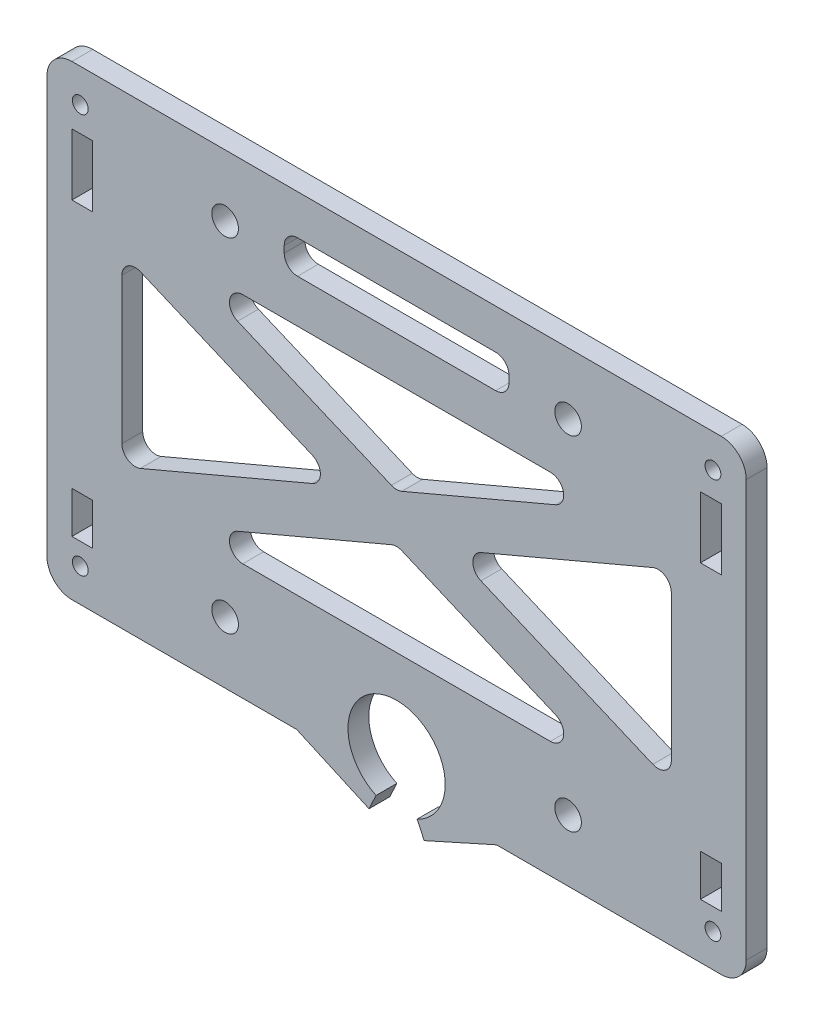
from build123d import *

# Parameters (mm, degrees)
SKETCH1_R           = 0.60325
SKETCH1_R_2         = 1.016
BOSS_EXTRUDE1_DEPTH = 1.5875
SPEED_HOLES_REACH   = 35.53
SKETCH2_W           = 17.145
SKETCH2_H           = 2.54
FILLET1_R           = 1.016
SKETCH5_W           = 1.5875
SKETCH5_H           = 3.175
SKETCH5_H_2         = 4.699
CUT_EXTRUDE1_DEPTH  = 34.530212411


with BuildPart() as part:
    # Sketch1 → Boss-Extrude1 (new body)
    with BuildSketch(Plane.XY):
        with BuildLine():
            ThreePointArc((26.67, 15.875), (26.112038418, 17.222038418), (24.765, 17.78))
            Line((24.765, 17.78), (-24.765, 17.78))
            ThreePointArc((-24.765, 17.78), (-26.112038418, 17.222038418), (-26.67, 15.875))
            Line((-26.67, 15.875), (-26.67, -15.875))
            ThreePointArc((-26.67, -15.875), (-26.112038418, -17.222038418), (-24.765, -17.78))
            Line((-24.765, -17.78), (-7.62, -17.78))
            Line((-7.62, -17.78), (-2.103962754, -20.259962687))
            Line((-2.103962754, -20.259962687), (-1.567237562, -19.108951797))
            ThreePointArc((-1.567237562, -19.108951797), (0, -12.0396), (1.567237562, -19.108951797))
            Line((1.567237562, -19.108951797), (2.103962754, -20.259962687))
            Line((2.103962754, -20.259962687), (7.62, -17.78))
            Line((7.62, -17.78), (24.765, -17.78))
            ThreePointArc((24.765, -17.78), (26.112038418, -17.222038418), (26.67, -15.875))
            Line((26.67, -15.875), (26.67, 15.875))
        make_face()
        with Locations((-24.13, -15.24)):
            Circle(SKETCH1_R, mode=Mode.SUBTRACT)
        with Locations((-13.08, -13.08)):
            Circle(SKETCH1_R_2, mode=Mode.SUBTRACT)
        with Locations((13.08, -13.08)):
            Circle(SKETCH1_R_2, mode=Mode.SUBTRACT)
        with Locations((24.13, -15.24)):
            Circle(SKETCH1_R, mode=Mode.SUBTRACT)
        with Locations((-24.13, 15.24)):
            Circle(SKETCH1_R, mode=Mode.SUBTRACT)
        with Locations((-13.08, 13.08)):
            Circle(SKETCH1_R_2, mode=Mode.SUBTRACT)
        with Locations((13.08, 13.08)):
            Circle(SKETCH1_R_2, mode=Mode.SUBTRACT)
        with Locations((24.13, 15.24)):
            Circle(SKETCH1_R, mode=Mode.SUBTRACT)
    extrude(amount=BOSS_EXTRUDE1_DEPTH)

    # Sketch2 → Speed Holes (cut, up to next)
    with BuildSketch(Plane.XY.offset(1.5875), mode=Mode.PRIVATE) as speed_holes_sk1:
        Polygon((4.227373313, 0), (20.955, -7.096568898), (20.955, 7.096568898), align=None)
    speed_holes_tool1 = extrude(speed_holes_sk1.sketch, amount=-SPEED_HOLES_REACH, mode=Mode.PRIVATE) & part.part
    # Sketch2 → Speed Holes (cut, up to next)
    with BuildSketch(Plane.XY.offset(1.5875), mode=Mode.PRIVATE) as speed_holes_sk2:
        Polygon((-16.727626687, 8.89), (0, 1.793431102), (16.727626687, 8.89), align=None)
    speed_holes_tool2 = extrude(speed_holes_sk2.sketch, amount=-SPEED_HOLES_REACH, mode=Mode.PRIVATE) & part.part
    # Sketch2 → Speed Holes (cut, up to next)
    with BuildSketch(Plane.XY.offset(1.5875), mode=Mode.PRIVATE) as speed_holes_sk3:
        Polygon((16.727626687, -8.89), (0, -1.793431102), (-16.727626687, -8.89), align=None)
    speed_holes_tool3 = extrude(speed_holes_sk3.sketch, amount=-SPEED_HOLES_REACH, mode=Mode.PRIVATE) & part.part
    # Sketch2 → Speed Holes (cut, up to next)
    with BuildSketch(Plane.XY.offset(1.5875), mode=Mode.PRIVATE) as speed_holes_sk4:
        Polygon((-20.955, -7.096568898), (-4.227373313, 0), (-20.955, 7.096568898), align=None)
    speed_holes_tool4 = extrude(speed_holes_sk4.sketch, amount=-SPEED_HOLES_REACH, mode=Mode.PRIVATE) & part.part
    # Sketch2 → Speed Holes (cut, up to next)
    with BuildSketch(Plane.XY.offset(1.5875), mode=Mode.PRIVATE) as speed_holes_sk5:
        with Locations((0, 13.462)):
            Rectangle(SKETCH2_W, SKETCH2_H)
    speed_holes_tool5 = extrude(speed_holes_sk5.sketch, amount=-SPEED_HOLES_REACH, mode=Mode.PRIVATE) & part.part
    add(speed_holes_tool1.solids().sort_by_distance((15.379124, 0, 1.5875))[0], mode=Mode.SUBTRACT)
    add(speed_holes_tool2.solids().sort_by_distance((0, 6.524477, 1.5875))[0], mode=Mode.SUBTRACT)
    add(speed_holes_tool3.solids().sort_by_distance((0, -6.524477, 1.5875))[0], mode=Mode.SUBTRACT)
    add(speed_holes_tool4.solids().sort_by_distance((-15.379124, 0, 1.5875))[0], mode=Mode.SUBTRACT)
    add(speed_holes_tool5.solids().sort_by_distance((0, 13.462, 1.5875))[0], mode=Mode.SUBTRACT)

    # Fillet1
    fillet1_edges = [part.edges().sort_by_distance(p)[0] for p in [
        (-16.727626687, -8.89, 0.79375),
        (-20.955, -7.096568898, 0.79375),
        (0, 1.793431102, 0.79375),
        (16.727626687, -8.89, 0.79375),
        (20.955, -7.096568898, 0.79375),
        (20.955, 7.096568898, 0.79375),
        (-4.227373313, 0, 0.79375),
        (16.727626687, 8.89, 0.79375),
        (4.227373313, 0, 0.79375),
        (-16.727626687, 8.89, 0.79375),
        (0, -1.793431102, 0.79375),
        (-20.955, 7.096568898, 0.79375),
        (-8.5725, 14.732, 0.79375),
        (-8.5725, 12.192, 0.79375),
        (8.5725, 14.732, 0.79375),
        (8.5725, 12.192, 0.79375),
    ]]
    fillet(fillet1_edges, radius=FILLET1_R)

    # Sketch5 → Cut-Extrude1 (cut, through all)
    with BuildSketch(Plane.XY.offset(1.5875)):
        with Locations((23.97125, -12.011129894)):
            Rectangle(SKETCH5_W, SKETCH5_H)
        with Locations((23.97125, 10.975870106)):
            Rectangle(SKETCH5_W, SKETCH5_H_2)
    cut_extrude1 = extrude(amount=-CUT_EXTRUDE1_DEPTH, mode=Mode.SUBTRACT)

    # Mirror1: Cut-Extrude1 across plane
    add(cut_extrude1.mirror(Plane(origin=(0, 0, 0), x_dir=(0, 0, 1), z_dir=(1, 0, 0))), mode=Mode.SUBTRACT)


solid = part.part
